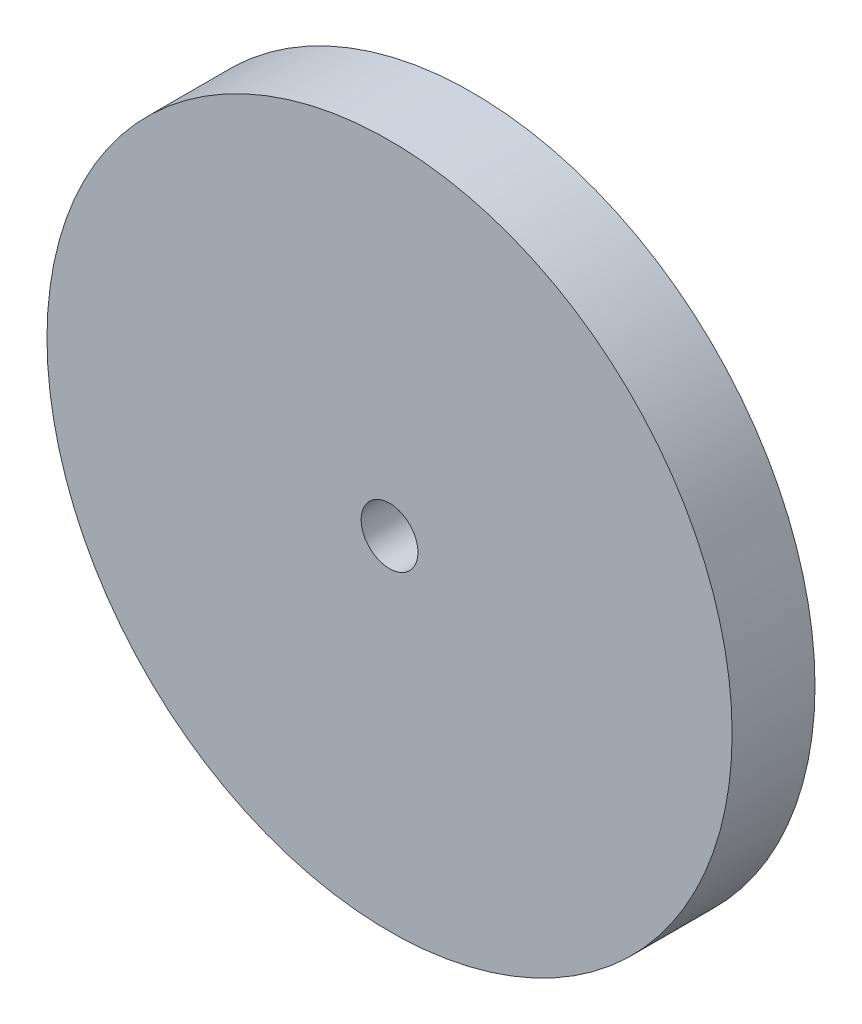
from build123d import *

# Parameters (mm, degrees)
SKETCH1_R           = 24.145
SKETCH1_R_2         = 2
BOSS_EXTRUDE1_DEPTH = 5.842


with BuildPart() as part:
    # Sketch1 → Boss-Extrude1 (new body)
    with BuildSketch(Plane.XY.offset(4.7625)):
        with Locations((-35.533137827, 0)):
            Circle(SKETCH1_R)
        with Locations((-35.533137827, 0)):
            Circle(SKETCH1_R_2, mode=Mode.SUBTRACT)
    extrude(amount=BOSS_EXTRUDE1_DEPTH)


solid = part.part
